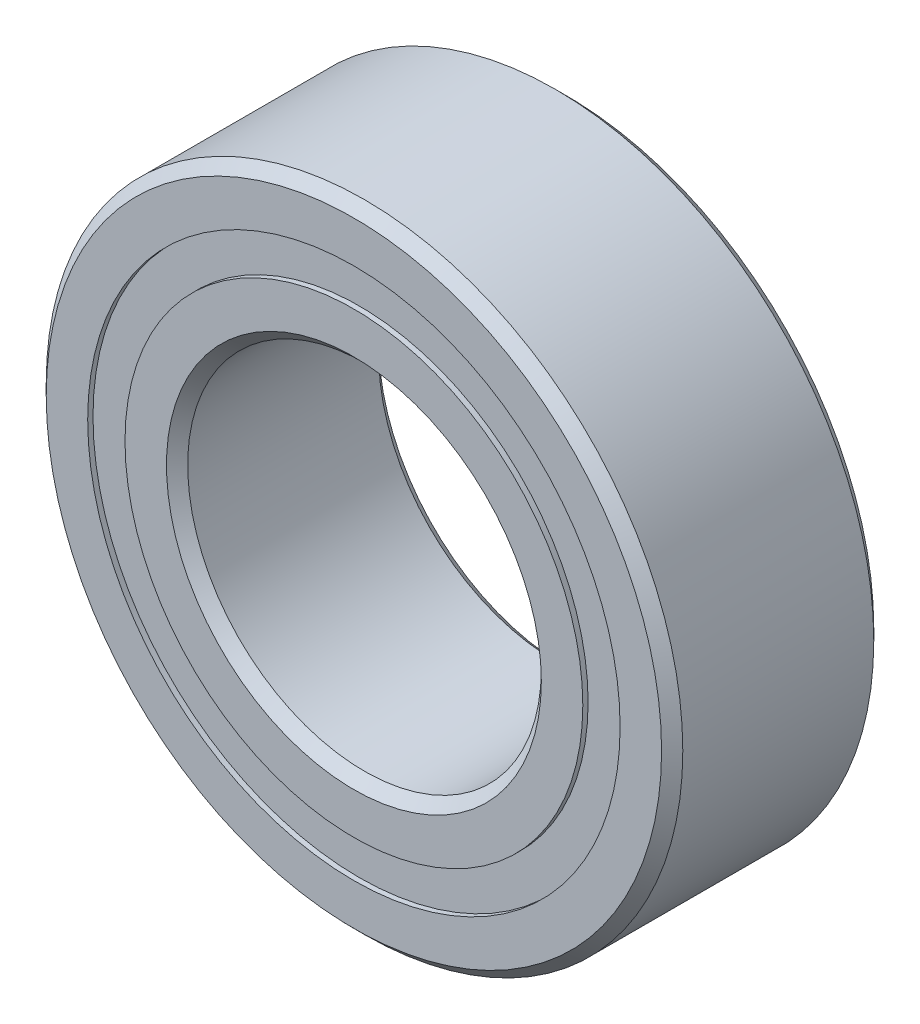
from build123d import *

# Parameters (mm, degrees)
CIRPATTERN1_COUNT = 12
SKETCH5_W         = 0.708061187
SKETCH5_H         = 0.527472528


with BuildPart() as part:
    # Sketch1 → Revolve1 (revolve)
    with BuildSketch(Plane(origin=(0, 0, 0), x_dir=(0, 0, -1), z_dir=(1, 0, 0))):
        with BuildLine():
            Line((1.35, 4.5), (-1.35, 4.5))
            Line((-1.35, 4.5), (-1.5, 4.35))
            Line((-1.5, 4.35), (-1.5, 3.763736264))
            Line((-1.5, 3.763736264), (-0.666666667, 3.763736264))
            ThreePointArc((-0.666666667, 3.763736264), (0, 4.216938813), (0.666666667, 3.763736264))
            Line((0.666666667, 3.763736264), (1.5, 3.763736264))
            Line((1.5, 3.763736264), (1.5, 4.35))
            Line((1.5, 4.35), (1.35, 4.5))
        make_face()
    revolve(axis=Axis((0, 0, 1.5), (0, 0, -1)))


with BuildPart() as body_2:
    # Sketch3 → Revolve3 (revolve)
    with BuildSketch(Plane(origin=(0, 0, 0), x_dir=(0, 0, -1), z_dir=(1, 0, 0))):
        with BuildLine():
            Line((-1.5, 3.236263736), (-0.666666667, 3.236263736))
            ThreePointArc((-0.666666667, 3.236263736), (0, 2.783061187), (0.666666667, 3.236263736))
            Line((0.666666667, 3.236263736), (1.5, 3.236263736))
            Line((1.5, 3.236263736), (1.5, 2.65))
            Line((1.5, 2.65), (1.35, 2.5))
            Line((1.35, 2.5), (-1.35, 2.5))
            Line((-1.35, 2.5), (-1.5, 2.65))
            Line((-1.5, 2.65), (-1.5, 3.236263736))
        make_face()
    revolve(axis=Axis((0, 0, 1.5), (0, 0, -1)))


with BuildPart() as body_3:
    # Sketch4 → Revolve4 (revolve)
    with BuildSketch(Plane(origin=(0, 0, 0), x_dir=(0, 0, -1), z_dir=(1, 0, 0))):
        with BuildLine():
            Line((-0.716938813, 3.5), (0.716938813, 3.5))
            ThreePointArc((0.716938813, 3.5), (0, 4.216938813), (-0.716938813, 3.5))
        make_face()
    revolve(axis=Axis((0, 3.5, 0.716938813), (0, 0, -1)))


with BuildPart() as cirpattern1_1:
    # CirPattern1: pattern copy
    add(body_3.part.rotate(Axis((0, 0, -1.5), (0, 0, 1)), 1 * 360 / CIRPATTERN1_COUNT))


with BuildPart() as cirpattern1_2:
    # CirPattern1: pattern copy
    add(body_3.part.rotate(Axis((0, 0, -1.5), (0, 0, 1)), 2 * 360 / CIRPATTERN1_COUNT))


with BuildPart() as cirpattern1_3:
    # CirPattern1: pattern copy
    add(body_3.part.rotate(Axis((0, 0, -1.5), (0, 0, 1)), 3 * 360 / CIRPATTERN1_COUNT))


with BuildPart() as cirpattern1_4:
    # CirPattern1: pattern copy
    add(body_3.part.rotate(Axis((0, 0, -1.5), (0, 0, 1)), 4 * 360 / CIRPATTERN1_COUNT))


with BuildPart() as cirpattern1_5:
    # CirPattern1: pattern copy
    add(body_3.part.rotate(Axis((0, 0, -1.5), (0, 0, 1)), 5 * 360 / CIRPATTERN1_COUNT))


with BuildPart() as cirpattern1_6:
    # CirPattern1: pattern copy
    add(body_3.part.rotate(Axis((0, 0, -1.5), (0, 0, 1)), 6 * 360 / CIRPATTERN1_COUNT))


with BuildPart() as cirpattern1_7:
    # CirPattern1: pattern copy
    add(body_3.part.rotate(Axis((0, 0, -1.5), (0, 0, 1)), 7 * 360 / CIRPATTERN1_COUNT))


with BuildPart() as cirpattern1_8:
    # CirPattern1: pattern copy
    add(body_3.part.rotate(Axis((0, 0, -1.5), (0, 0, 1)), 8 * 360 / CIRPATTERN1_COUNT))


with BuildPart() as cirpattern1_9:
    # CirPattern1: pattern copy
    add(body_3.part.rotate(Axis((0, 0, -1.5), (0, 0, 1)), 9 * 360 / CIRPATTERN1_COUNT))


with BuildPart() as cirpattern1_10:
    # CirPattern1: pattern copy
    add(body_3.part.rotate(Axis((0, 0, -1.5), (0, 0, 1)), 10 * 360 / CIRPATTERN1_COUNT))


with BuildPart() as cirpattern1_11:
    # CirPattern1: pattern copy
    add(body_3.part.rotate(Axis((0, 0, -1.5), (0, 0, 1)), 11 * 360 / CIRPATTERN1_COUNT))


with BuildPart() as body_15:
    # Sketch5 → Revolve5 (revolve)
    with BuildSketch(Plane(origin=(0, 0, 0), x_dir=(0, 0, -1), z_dir=(1, 0, 0))):
        with Locations((-1.070969407, 3.5)):
            Rectangle(SKETCH5_W, SKETCH5_H)
        with Locations((1.070969407, 3.5)):
            Rectangle(SKETCH5_W, SKETCH5_H)
    revolve(axis=Axis((0, 0, 1.5), (0, 0, -1)))


solid = Compound([part.part, body_2.part, body_3.part, cirpattern1_1.part, cirpattern1_2.part, cirpattern1_3.part, cirpattern1_4.part, cirpattern1_5.part, cirpattern1_6.part, cirpattern1_7.part, cirpattern1_8.part, cirpattern1_9.part, cirpattern1_10.part, cirpattern1_11.part, body_15.part])
